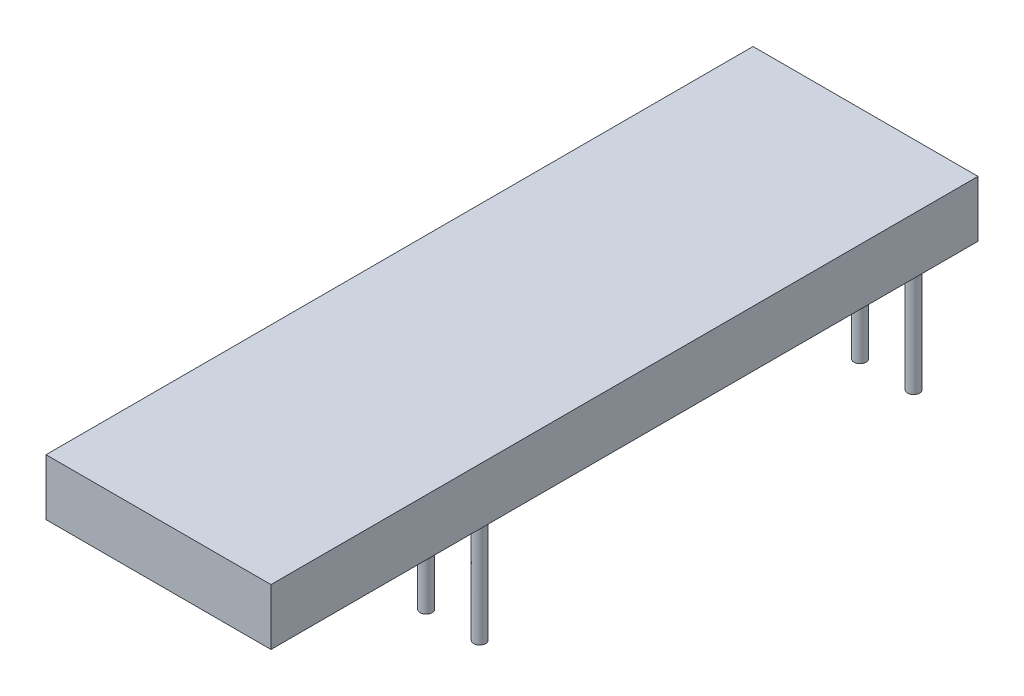
from build123d import *

# Parameters (mm, degrees)
SKETCH2_W           = 14
SKETCH2_H           = 44
BOSS_EXTRUDE1_DEPTH = 3.5
SKETCH4_R           = 0.375
BOSS_EXTRUDE3_DEPTH = 8
LPATTERN1_COUNT     = 2
LPATTERN1_PITCH     = 27


with BuildPart() as part:
    # Sketch2 → Boss-Extrude1 (new body)
    with BuildSketch(Plane(origin=(0, 0, 0), x_dir=(1, 0, 0), z_dir=(0, 1, 0))):
        Rectangle(SKETCH2_W, SKETCH2_H)
    extrude(amount=BOSS_EXTRUDE1_DEPTH)

    # Sketch4 → Boss-Extrude3 (add)
    with BuildSketch(Plane.XZ):
        with Locations((-5, 7)):
            Circle(SKETCH4_R)
        with Locations((-1.67, 7)):
            Circle(SKETCH4_R)
        with Locations((1.66, 7)):
            Circle(SKETCH4_R)
        with Locations((4.99, 7)):
            Circle(SKETCH4_R)
    boss_extrude3 = extrude(amount=BOSS_EXTRUDE3_DEPTH)

    # LPattern1: Boss-Extrude3 ×2
    with Locations(*[(0, 0, -i * LPATTERN1_PITCH) for i in range(1, LPATTERN1_COUNT)]):
        add(boss_extrude3)


solid = part.part
